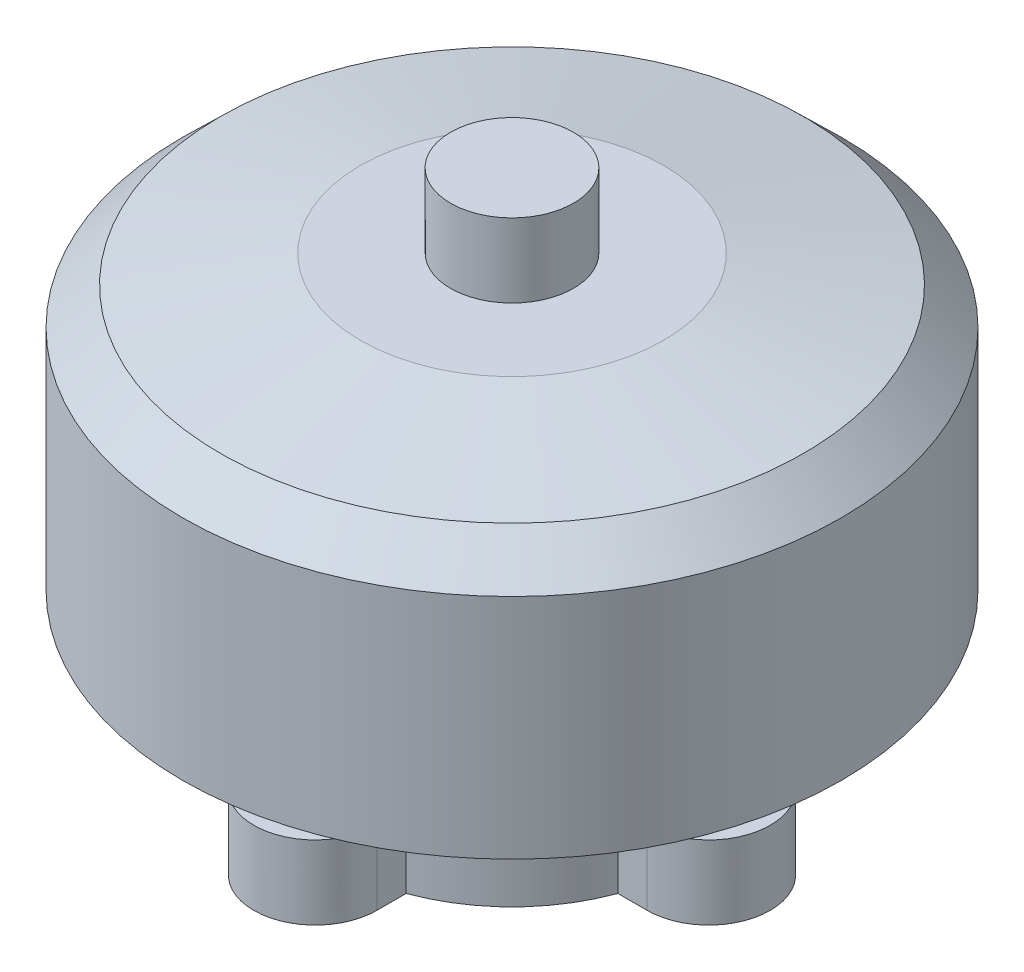
from build123d import *
from build123d.topology import SkipClean

# Parameters (mm, degrees)
SKETCH_1_R                      = 1.25
SKETCH_1_R_2                    = 6
EXTRUDE_1_DEPTH                 = 3
SKETCH_3_R                      = 1.25
CUT_EXTRUDE_1_DEPTH             = 16.516120649
EXTRUDE_2_DEPTH                 = 0.75
PATTERN_CIRCULAR_1_COPY_1_DEPTH = 0.75
PATTERN_CIRCULAR_1_COPY_2_DEPTH = 0.75
PATTERN_CIRCULAR_1_COPY_3_DEPTH = 0.75
PATTERN_CIRCULAR_1_COPY_4_DEPTH = 0.75
PATTERN_CIRCULAR_1_COPY_5_DEPTH = 0.75
PATTERN_CIRCULAR_1_COPY_6_DEPTH = 0.75
SKETCH_8_R                      = 2.5
EXTRUDE_3_DEPTH                 = 12.3
CHAMFER_2_SIZE                  = 0.5
CHAMFER_3_SIZE                  = 0.5
CUT_EXTRUDE1_START              = 3
SKETCH1_R                       = 3.297555615
CUT_EXTRUDE1_DEPTH              = 24.073040944


with BuildPart() as part:
    # Эскиз1 → Бобышка-Вытянуть1 (new body)
    with BuildSketch(Plane(origin=(0, 0, 0), x_dir=(1, 0, 0), z_dir=(0, 1, 0))):
        with BuildLine():
            Line((2.5, 6.805328794), (2.5, 8))
            ThreePointArc((2.5, 8), (0, 10.5), (-2.5, 8))
            Line((-2.5, 8), (-2.5, 6.805328794))
            ThreePointArc((-2.5, 6.805328794), (-5.126524164, 5.126524164), (-6.805328794, 2.5))
            Line((-6.805328794, 2.5), (-8, 2.5))
            ThreePointArc((-8, 2.5), (-10.5, 0), (-8, -2.5))
            Line((-8, -2.5), (-6.805328794, -2.5))
            ThreePointArc((-6.805328794, -2.5), (-5.126524164, -5.126524164), (-2.5, -6.805328794))
            Line((-2.5, -6.805328794), (-2.5, -8))
            ThreePointArc((-2.5, -8), (0, -10.5), (2.5, -8))
            Line((2.5, -8), (2.5, -6.805328794))
            ThreePointArc((2.5, -6.805328794), (5.126524164, -5.126524164), (6.805328794, -2.5))
            Line((6.805328794, -2.5), (8, -2.5))
            ThreePointArc((8, -2.5), (10.5, 0), (8, 2.5))
            Line((8, 2.5), (6.805328794, 2.5))
            ThreePointArc((6.805328794, 2.5), (5.126524164, 5.126524164), (2.5, 6.805328794))
        make_face()
        with Locations((0, 8)):
            Circle(SKETCH_1_R, mode=Mode.SUBTRACT)
        Circle(SKETCH_1_R_2, mode=Mode.SUBTRACT)
        with Locations((8, 0)):
            Circle(SKETCH_1_R, mode=Mode.SUBTRACT)
        with Locations((-8, 0)):
            Circle(SKETCH_1_R, mode=Mode.SUBTRACT)
        with Locations((0, -8)):
            Circle(SKETCH_1_R, mode=Mode.SUBTRACT)
    extrude(amount=EXTRUDE_1_DEPTH)

    # Эскиз2 → Повернуть1 (revolve)
    with BuildSketch(Plane(origin=(0, 0, 0), x_dir=(0, 0, -1), z_dir=(1, 0, 0))):
        Polygon((6, 3), (4.2, 4.5), (0, 4.5), (0, 5.5), (3.805328794, 5.5), (6.805328794, 3), align=None)
    revolve(axis=Axis((0, 4.5, 0), (0, 1, 0)))

    # Эскиз3 → Вырез-Вытянуть1 (cut, through all)
    with BuildSketch(Plane.XZ.offset(-4.5)):
        Circle(SKETCH_3_R)
    extrude(amount=-CUT_EXTRUDE_1_DEPTH, mode=Mode.SUBTRACT)

    # Эскиз4 → Бобышка-Вытянуть2 (add)
    with SkipClean():  # the faces are left unmerged after this step: merging them gives an invalid solid
        with BuildSketch(Plane.XY.offset(2.5)):
            Polygon((8.0234375, 3), (2.868889547, 5.5), (6.329494451, 3), (6.805328794, 3), align=None)
        extrude_2 = extrude(amount=-EXTRUDE_2_DEPTH)

    # Зеркальное отражение1: Бобышка-Вытянуть2 across plane
    add(extrude_2.mirror(Plane.XY))

    # Круговой массив1 copy 1 sketch → Круговой массив1 copy 1 (add)
    with BuildSketch(Plane(origin=(2.5, 0, 0), x_dir=(0, 0, 1), z_dir=(1, 0, 0))):
        Polygon((8.0234375, -3), (2.868889547, -5.5), (6.329494451, -3), (6.805328794, -3), align=None)
    extrude(amount=-PATTERN_CIRCULAR_1_COPY_1_DEPTH)

    # Круговой массив1 copy 2 sketch → Круговой массив1 copy 2 (add)
    with BuildSketch(Plane(origin=(0, 0, 2.5), x_dir=(-1, 0, 0), z_dir=(0, 0, 1))):
        Polygon((8.0234375, -3), (2.868889547, -5.5), (6.329494451, -3), (6.805328794, -3), align=None)
    extrude(amount=-PATTERN_CIRCULAR_1_COPY_2_DEPTH)

    # Круговой массив1 copy 3 sketch → Круговой массив1 copy 3 (add)
    with BuildSketch(Plane(origin=(-2.5, 0, 0), x_dir=(0, 0, -1), z_dir=(-1, 0, 0))):
        Polygon((8.0234375, -3), (2.868889547, -5.5), (6.329494451, -3), (6.805328794, -3), align=None)
    extrude(amount=-PATTERN_CIRCULAR_1_COPY_3_DEPTH)

    # Круговой массив1 copy 4 sketch → Круговой массив1 copy 4 (add)
    with BuildSketch(Plane.ZY.offset(2.5)):
        Polygon((8.0234375, 3), (2.868889547, 5.5), (6.329494451, 3), (6.805328794, 3), align=None)
    extrude(amount=-PATTERN_CIRCULAR_1_COPY_4_DEPTH)

    # Круговой массив1 copy 5 sketch → Круговой массив1 copy 5 (add)
    with BuildSketch(Plane(origin=(0, 0, -2.5), x_dir=(-1, 0, 0), z_dir=(0, 0, -1))):
        Polygon((8.0234375, 3), (2.868889547, 5.5), (6.329494451, 3), (6.805328794, 3), align=None)
    extrude(amount=-PATTERN_CIRCULAR_1_COPY_5_DEPTH)

    # Круговой массив1 copy 6 sketch → Круговой массив1 copy 6 (add)
    with BuildSketch(Plane(origin=(2.5, 0, 0), x_dir=(0, 0, -1), z_dir=(1, 0, 0))):
        Polygon((8.0234375, 3), (2.868889547, 5.5), (6.329494451, 3), (6.805328794, 3), align=None)
    extrude(amount=-PATTERN_CIRCULAR_1_COPY_6_DEPTH)

    # Эскиз7 → Повернуть3 (revolve)
    with BuildSketch(Plane.XY):
        Polygon((5.363228728, 4.290224088), (5.363228728, 6.03046627), (13.4, 6.03046627), (13.4, 15.28046627), (11.86181019, 16.777751396), (6.16327969, 17.907637033), (0, 17.907637033), (0, 4.290224088), align=None)
    revolve(axis=Axis((0, 17.907637033, 0), (0, -1, 0)))

    # Эскиз8 → Бобышка-Вытянуть3 (add)
    with BuildSketch(Plane(origin=(0, 17.907637033, 0), x_dir=(1, 0, 0), z_dir=(0, 1, 0))):
        Circle(SKETCH_8_R)
    extrude(amount=EXTRUDE_3_DEPTH)

    # Фаска2
    chamfer_2_edges = [part.edges().sort_by_distance(p)[0] for p in [
        (-2.5, 30.207637033, 0),
    ]]
    chamfer(chamfer_2_edges, length=CHAMFER_2_SIZE)

    # Фаска3
    chamfer_3_edges = [part.edges().sort_by_distance(p)[0] for p in [
        (-1.25, 0, -8),
        (6.75, 0, 0),
        (-1.25, 0, 8),
        (-9.25, 0, 0),
    ]]
    chamfer(chamfer_3_edges, length=CHAMFER_3_SIZE)

    # Sketch1 → Cut-Extrude1 (cut, through all)
    with BuildSketch(Plane(origin=(0, 17.907637033, 0), x_dir=(1, 0, 0), z_dir=(0, 1, 0)).offset(CUT_EXTRUDE1_START)):
        Circle(SKETCH1_R)
    extrude(amount=CUT_EXTRUDE1_DEPTH, mode=Mode.SUBTRACT)


solid = part.part
